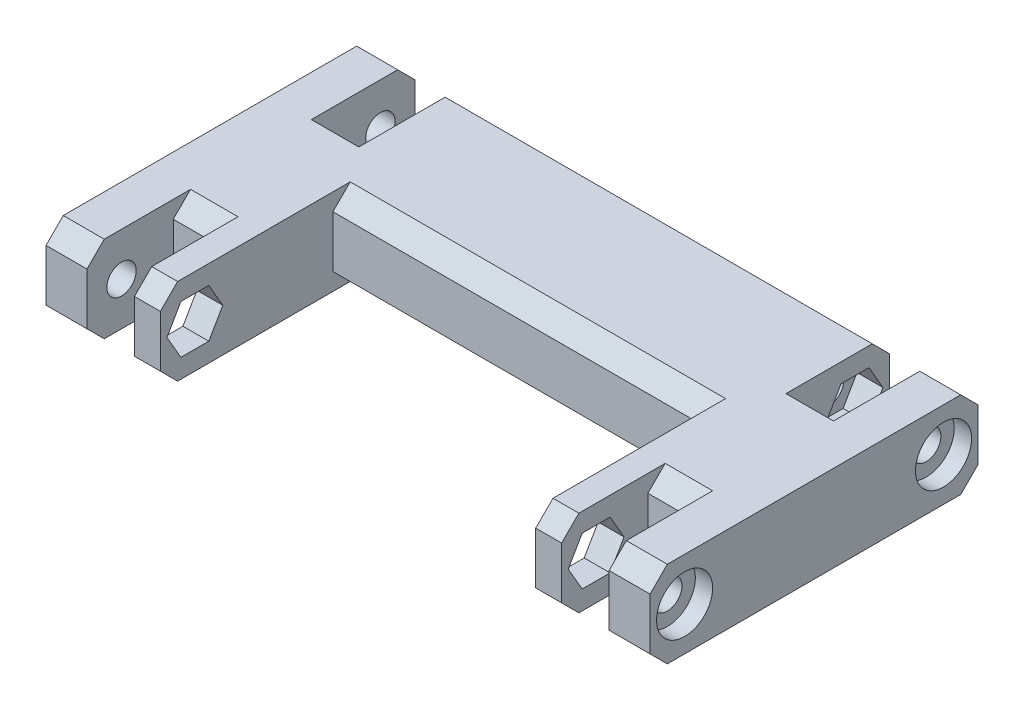
from build123d import *

# Parameters (mm, degrees)
SKETCH1_W            = 70
SKETCH1_H            = 38
BOSS_EXTRUDE1_DEPTH  = 10
SKETCH2_W            = 5.5
SKETCH2_H            = 10
CUT_EXTRUDE1_DEPTH   = 42.060930335
CUT_EXTRUDE2_DEPTH   = 3
MIRROR2_COPY_2_DEPTH = 3
CHAMFER1_SIZE        = 2
SKETCH10_W           = 43.5
SKETCH10_H           = 20
CUT_EXTRUDE3_DEPTH   = 42.060930335
CHAMFER2_SIZE        = 2
CHAMFER3_SIZE        = 2


with BuildPart() as part:
    # Sketch1 → Boss-Extrude1 (new body)
    with BuildSketch(Plane(origin=(0, 0, 0), x_dir=(1, 0, 0), z_dir=(0, 1, 0))):
        Rectangle(SKETCH1_W, SKETCH1_H)
    extrude(amount=BOSS_EXTRUDE1_DEPTH)

    # Sketch2 → Cut-Extrude1 (cut, through all)
    with BuildSketch(Plane(origin=(0, 10, 0), x_dir=(1, 0, 0), z_dir=(0, 1, 0))):
        with Locations((-27.5, 14)):
            Rectangle(SKETCH2_W, SKETCH2_H)
        with Locations((27.5, 14)):
            Rectangle(SKETCH2_W, SKETCH2_H)
    cut_extrude1 = extrude(amount=-CUT_EXTRUDE1_DEPTH, mode=Mode.SUBTRACT)

    # Sketch8 → CBORE for M3 Cheese Head Screw1 (revolve, cut)
    with BuildSketch(Plane(origin=(35, 5, -15), x_dir=(0, 0, -1), z_dir=(0, 1, 0))):
        Polygon((0, 0), (0, 16.021463052), (1.7, 15), (1.7, 2), (3.25, 2), (3.25, 0), align=None)
    cbore_for_m3_cheese_head_screw1 = revolve(axis=Axis((41.35, 5, -15), (-1, 0, 0)), mode=Mode.SUBTRACT)

    # Sketch9 → Cut-Extrude2 (cut)
    with BuildSketch(Plane(origin=(24.75, 0, 0), x_dir=(0, 0, -1), z_dir=(1, 0, 0))):
        Polygon((16.616580754, 7.8), (13.383419246, 7.8), (11.766838493, 5), (13.383419246, 2.2), (16.616580754, 2.2), (18.233161507, 5), align=None)
    cut_extrude2 = extrude(amount=-CUT_EXTRUDE2_DEPTH, mode=Mode.SUBTRACT)

    # Mirror1: CBORE for M3 Cheese Head Screw1, Cut-Extrude2 across plane
    add(cbore_for_m3_cheese_head_screw1.mirror(Plane(origin=(0, 0, 0), x_dir=(0, 0, 1), z_dir=(1, 0, 0))), mode=Mode.SUBTRACT)
    add(cut_extrude2.mirror(Plane(origin=(0, 0, 0), x_dir=(0, 0, 1), z_dir=(1, 0, 0))), mode=Mode.SUBTRACT)

    # Mirror2: Cut-Extrude1, CBORE for M3 Cheese Head Screw1, Cut-Extrude2 across plane
    add(cut_extrude1.mirror(Plane.XY), mode=Mode.SUBTRACT)
    add(cbore_for_m3_cheese_head_screw1.mirror(Plane.XY), mode=Mode.SUBTRACT)
    add(cut_extrude2.mirror(Plane.XY), mode=Mode.SUBTRACT)

    # Mirror2 copy 1 sketch → Mirror2 copy 1 (revolve, cut)
    with BuildSketch(Plane(origin=(-35, 5, 15), x_dir=(0, 0, 1), z_dir=(0, 1, 0))):
        Polygon((0, 0), (0, 16.021463052), (1.7, 15), (1.7, 2), (3.25, 2), (3.25, 0), align=None)
    revolve(axis=Axis((-41.35, 5, 15), (1, 0, 0)), mode=Mode.SUBTRACT)

    # Mirror2 copy 2 sketch → Mirror2 copy 2 (cut)
    with BuildSketch(Plane.ZY.offset(24.75)):
        Polygon((16.616580754, 7.8), (13.383419246, 7.8), (11.766838493, 5), (13.383419246, 2.2), (16.616580754, 2.2), (18.233161507, 5), align=None)
    extrude(amount=-MIRROR2_COPY_2_DEPTH, mode=Mode.SUBTRACT)

    # Chamfer1
    chamfer1_edges = [part.edges().sort_by_distance(p)[0] for p in [
        (32.625, 0, -19),
        (32.625, 10, -19),
        (0, 0, -19),
        (0, 10, -19),
        (-32.625, 0, -19),
        (-32.625, 10, -19),
        (-32.625, 0, 19),
        (32.625, 0, 19),
        (0, 0, 19),
        (32.625, 10, 19),
        (-32.625, 10, 19),
        (0, 10, 19),
    ]]
    chamfer(chamfer1_edges, length=CHAMFER1_SIZE)

    # Sketch10 → Cut-Extrude3 (cut, through all)
    with BuildSketch(Plane(origin=(0, 10, 0), x_dir=(1, 0, 0), z_dir=(0, 1, 0))):
        with Locations((0, -9)):
            Rectangle(SKETCH10_W, SKETCH10_H)
    extrude(amount=-CUT_EXTRUDE3_DEPTH, mode=Mode.SUBTRACT)

    # Chamfer2
    chamfer2_edges = [part.edges().sort_by_distance(p)[0] for p in [
        (0, 0, -1),
        (0, 10, -1),
    ]]
    chamfer(chamfer2_edges, length=CHAMFER2_SIZE)

    # Chamfer3
    chamfer3_edges = [part.edges().sort_by_distance(p)[0] for p in [
        (27.5, 0, -9),
        (27.5, 10, -9),
        (27.5, 10, 9),
        (27.5, 0, 9),
        (-27.5, 10, 9),
        (-27.5, 0, 9),
        (-27.5, 0, -9),
        (-27.5, 10, -9),
    ]]
    chamfer(chamfer3_edges, length=CHAMFER3_SIZE)


solid = part.part
